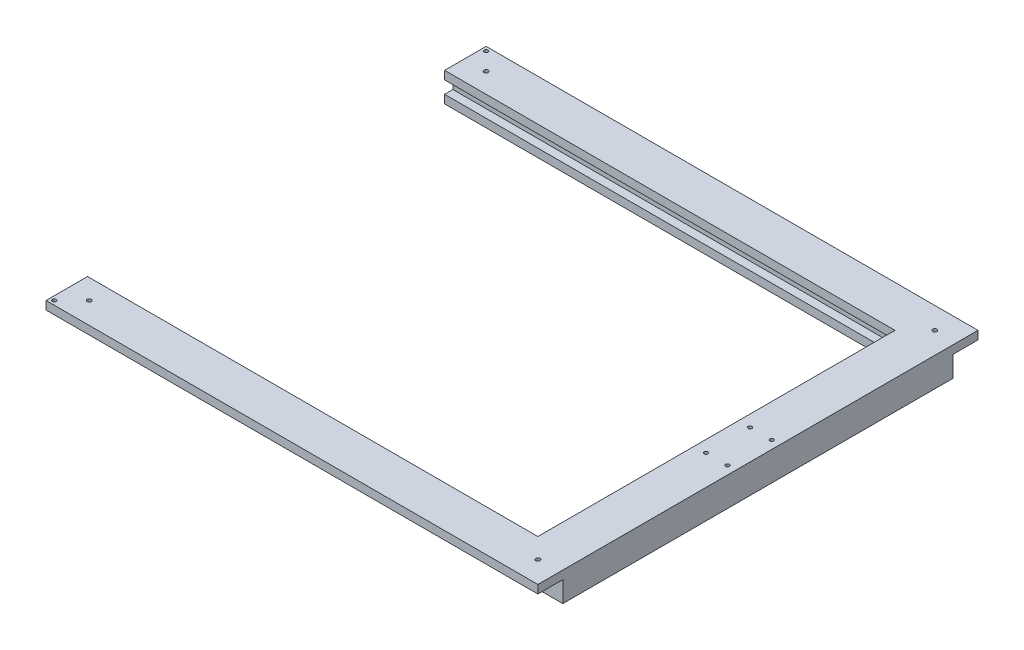
from build123d import *

# Parameters (mm, degrees)
EXTRUDE_2_DEPTH             = 10
EXTRUDE_3_DEPTH             = 15
SKETCH_4_R                  = 2.5
CUT_EXTRUDE_1_DEPTH         = 816.035490032
PATTERN_LINEAR_2_COUNT      = 2
PATTERN_LINEAR_2_PITCH      = 540.3
PATTERN_LINEAR_2_COUNT_DIR2 = 2
PATTERN_LINEAR_2_PITCH_DIR2 = 478
EXTRUDE_4_DEPTH             = 10
SKETCH_6_R                  = 2.25
CUT_EXTRUDE_2_DEPTH         = 816.403489085
SKETCH_7_R                  = 2.25
CUT_EXTRUDE_3_DEPTH         = 816.035490032


with BuildPart() as part:
    # Эскиз1 → Бобышка-Вытянуть2 (new body)
    with BuildSketch(Plane(origin=(0, 0, 0), x_dir=(1, 0, 0), z_dir=(0, 1, 0))):
        Polygon((50, -77.921508101), (50, -607.921508101), (-542.3, -607.921508101), (-542.3, -557.921508101), (0, -557.921508101), (0, -127.921508101), (-542.3, -127.921508101), (-542.3, -77.921508101), align=None)
    extrude(amount=EXTRUDE_2_DEPTH)

    # Эскиз2 → Бобышка-Вытянуть3 (add)
    with BuildSketch(Plane.XZ):
        Polygon((50, 577.921508101), (50, 107.921508101), (-542.3, 107.921508101), (-542.3, 117.921508101), (10, 117.921508101), (10, 567.921508101), (-542.3, 567.921508101), (-542.3, 577.921508101), align=None)
    extrude(amount=EXTRUDE_3_DEPTH)

    # Эскиз4 → Вырез-Вытянуть1 (cut, through all)
    with BuildSketch(Plane(origin=(0, 10, 0), x_dir=(1, 0, 0), z_dir=(0, 1, 0))):
        with Locations((-516.3, -103.921508101)):
            Circle(SKETCH_4_R)
    cut_extrude_1 = extrude(amount=-CUT_EXTRUDE_1_DEPTH, mode=Mode.SUBTRACT)

    # Линейный массив2: Cut-Extrude 1 2 × 2
    with Locations(*[(i * PATTERN_LINEAR_2_PITCH, 0, j * PATTERN_LINEAR_2_PITCH_DIR2) for i in range(PATTERN_LINEAR_2_COUNT) for j in range(PATTERN_LINEAR_2_COUNT_DIR2) if (i, j) != (0, 0)]):
        add(cut_extrude_1, mode=Mode.SUBTRACT)

    # Эскиз5 → Бобышка-Вытянуть4 (add)
    with BuildSketch(Plane.XZ.offset(15)):
        Polygon((50, 577.921508101), (-542.3, 577.921508101), (-542.3, 557.921508101), (0, 557.921508101), (0, 127.921508101), (-542.3, 127.921508101), (-542.3, 107.921508101), (50, 107.921508101), align=None)
    extrude(amount=EXTRUDE_4_DEPTH)

    # Эскиз6 → Вырез-Вытянуть2 (cut, through all)
    with BuildSketch(Plane.XZ.offset(25)):
        with Locations((14, 369.421508101)):
            Circle(SKETCH_6_R)
        with Locations((40, 369.421508101)):
            Circle(SKETCH_6_R)
        with Locations((40, 316.421508101)):
            Circle(SKETCH_6_R)
        with Locations((14, 316.421508101)):
            Circle(SKETCH_6_R)
    extrude(amount=-CUT_EXTRUDE_2_DEPTH, mode=Mode.SUBTRACT)

    # Эскиз7 → Вырез-Вытянуть3 (cut, through all)
    with BuildSketch(Plane.XZ):
        with Locations((-537.3, 602.921508101)):
            Circle(SKETCH_7_R)
        with Locations((-537.3, 82.921508101)):
            Circle(SKETCH_7_R)
    extrude(amount=-CUT_EXTRUDE_3_DEPTH, mode=Mode.SUBTRACT)


solid = part.part
